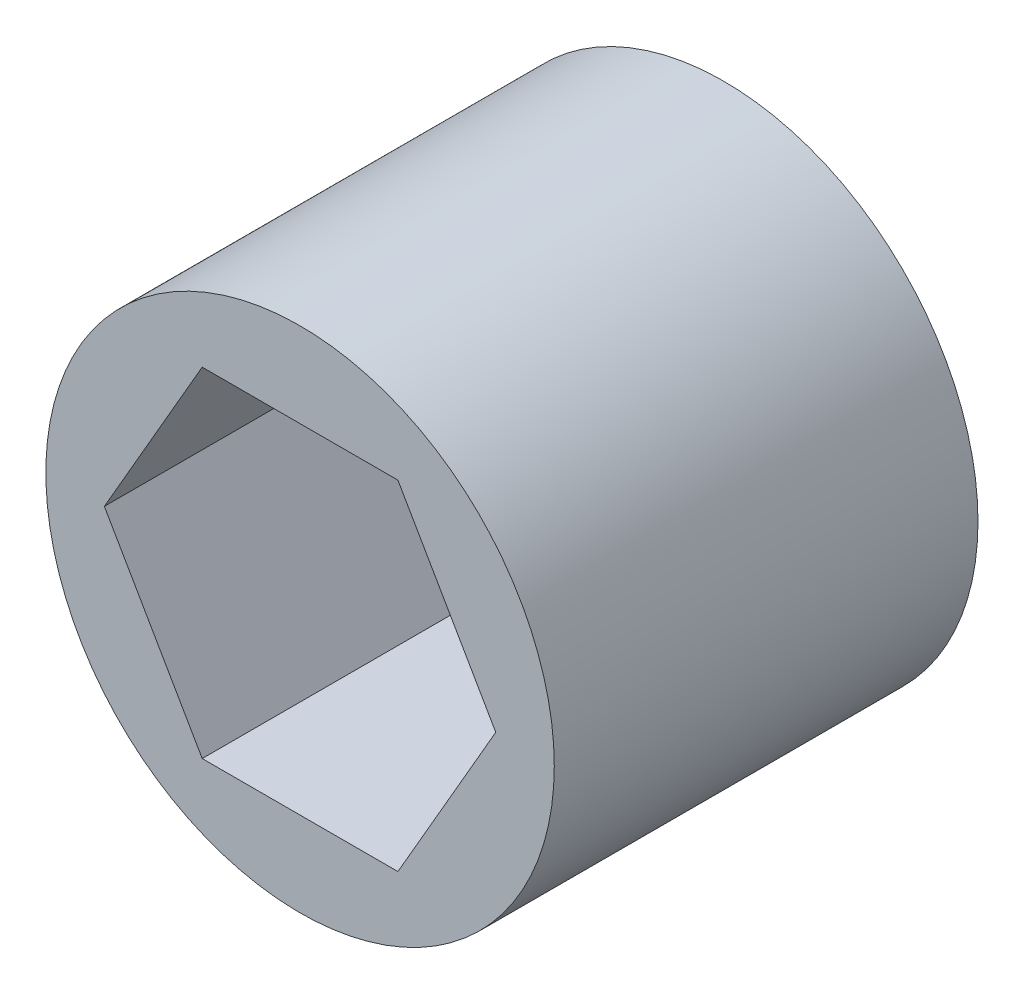
from build123d import *

# Parameters (mm, degrees)
SKETCH1_R           = 9.525
BOSS_EXTRUDE1_DEPTH = 15.875


with BuildPart() as part:
    # Sketch1 → Boss-Extrude1 (new body)
    with BuildSketch(Plane.XY):
        Circle(SKETCH1_R)
        Polygon((-3.666174209, 6.35), (-7.332348419, 0), (-3.666174209, -6.35), (3.666174209, -6.35), (7.332348419, 0), (3.666174209, 6.35), align=None, mode=Mode.SUBTRACT)
    extrude(amount=BOSS_EXTRUDE1_DEPTH)


solid = part.part
